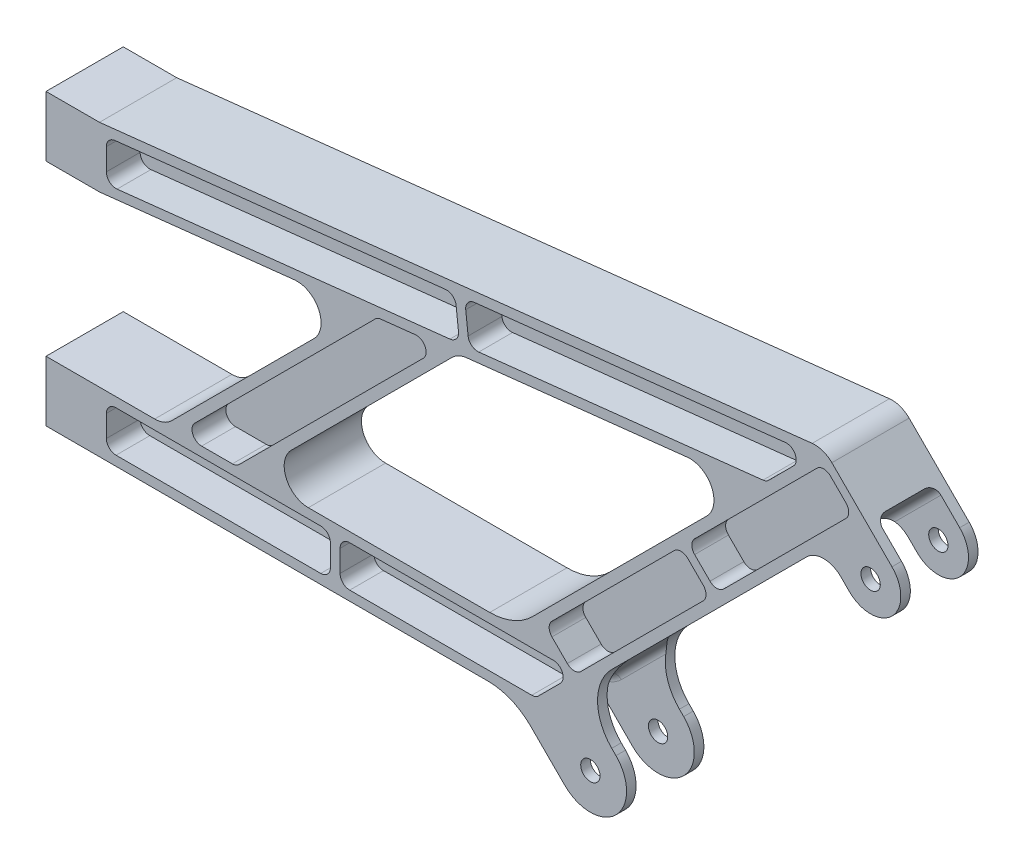
from build123d import *

# Parameters (mm, degrees)
SKETCH1_R               = 4.000000000000007
SKETCH1_R_2             = 4
BOSS_EXTRUDE1_DEPTH     = 32
CUT_EXTRUDE1_DEPTH      = 14
CUT_EXTRUDE2_DEPTH      = 12.0515
CUT_EXTRUDE2_DEPTH_BACK = 12.0515
FILLET1_R               = 4
FILLET2_R               = 4
SKETCH7_R               = 4
SKETCH7_R_2             = 3.999999999999997
SKETCH7_R_3             = 4.000000000000001
SKETCH7_R_4             = 4.0000000000000036
CUT_EXTRUDE3_DEPTH      = 14


with BuildPart() as part:
    # Sketch1 → Boss-Extrude1 (new body)
    with BuildSketch(Plane.XY):
        with BuildLine():
            Line((-16.049733998308586, 33.731487378633574), (8.839559805780222, 8.8381095989473))
            ThreePointArc((8.839559805780222, 8.8381095989473), (12.499999986501061, -0.00051272800107638), (8.838834762594171, -8.838834767069468))
            ThreePointArc((8.838834762594171, -8.838834767069468), (-1.5822419e-09, -12.500000000000004), (-8.838834764831827, -8.838834764831867))
            Line((-8.838834764831827, -8.838834764831867), (-12.374368671510593, -5.303300858153129))
            ThreePointArc((-12.374368671510593, -5.303300858153129), (-19.44543648337603, -2.3743686700186277), (-26.516504295241493, -5.303300858153101))
            Line((-26.516504295241493, -5.303300858153101), (-107.24873734525912, -86.0355339081699))
            ThreePointArc((-107.24873734525912, -86.0355339081699), (-113.10660172152828, -100.17766953190096), (-107.24873734525916, -114.31980515563204))
            Line((-107.24873734525916, -114.31980515563204), (-105.48097039229309, -116.0875721085981))
            ThreePointArc((-105.48097039229309, -116.0875721085981), (-101.08757211009126, -126.69417382639631), (-105.48097039229302, -137.30077554419455))
            ThreePointArc((-105.48097039229302, -137.30077554419455), (-116.0875721100912, -141.69417382639634), (-126.69417382788939, -137.3007755441946))
            Line((-126.69417382788939, -137.3007755441946), (-140.83255286115494, -123.16239651092909))
            ThreePointArc((-140.83255286115494, -123.16239651092909), (-148.94313658169136, -117.74307772781059), (-158.5102223908186, -115.84006604059276))
            Line((-158.5102223908186, -115.84006604059276), (-341.5776016752601, -115.84006604059276))
            Line((-341.5776016752601, -115.84006604059276), (-341.5776016752601, -90.84006604059276))
            Line((-341.5776016752601, -90.84006604059276), (-296.5582702488945, -90.84006604059275))
            ThreePointArc((-296.5582702488945, -90.84006604059275), (-292.7314359252436, -90.0788613657056), (-289.487202437029, -87.91113385245822))
            Line((-289.487202437029, -87.91113385245822), (-230.55965535531007, -28.983586770739237))
            ThreePointArc((-230.55965535531007, -28.983586770739237), (-228.6150903237555, -17.58604644276483), (-238.72309738144492, -11.972362090091522))
            Line((-238.72309738144492, -11.972362090091522), (-319.4176016752601, -20.840290120548644))
            Line((-319.4176016752601, -20.840290120548644), (-341.5776016752601, -20.840290120548637))
            Line((-341.5776016752601, -20.840290120548637), (-341.5776016752601, 4.159709879451362))
            Line((-341.5776016752601, 4.159709879451362), (-319.4176016743681, 4.159709879451346))
            Line((-319.4176016743681, 4.159709879451346), (-24.213756083384812, 36.60115654207939))
            ThreePointArc((-24.213756083384812, 36.60115654207939), (-19.80525783014332, 36.09515683534142), (-16.049733998308586, 33.731487378633574))
        make_face()
        with Locations((-116.08757211009124, -126.69417382639637)):
            Circle(SKETCH1_R, mode=Mode.SUBTRACT)
        with Locations((-2.98344682e-09, -2.98341907e-09)):
            Circle(SKETCH1_R_2, mode=Mode.SUBTRACT)
        with BuildLine():
            Line((-157.76394759633592, -90.84006604059275), (-232.91865994210522, -90.84006604059276))
            ThreePointArc((-232.91865994210522, -90.84006604059276), (-242.1574552672181, -84.66690036424366), (-239.9897277539707, -73.76899822872727))
            Line((-239.9897277539707, -73.76899822872727), (-173.37413117104185, -7.153401645798409))
            ThreePointArc((-173.37413117104185, -7.153401645798409), (-170.62953587528548, -5.2088366142439355), (-167.39543757344612, -4.284312588881645))
            Line((-167.39543757344612, -4.284312588881645), (-75.9815909030455, 5.76161830015324))
            ThreePointArc((-75.9815909030455, 5.76161830015324), (-65.87358384535577, 0.14793394747996658), (-67.81814887691054, -11.249606380494681))
            Line((-67.81814887691054, -11.249606380494681), (-140.08627806667224, -83.51773557025643))
            ThreePointArc((-140.08627806667224, -83.51773557025643), (-148.1968617872087, -88.93705435337492), (-157.76394759633592, -90.84006604059275))
        make_face(mode=Mode.SUBTRACT)
    extrude(amount=BOSS_EXTRUDE1_DEPTH)

    # Sketch2 → Cut-Extrude1 (cut)
    with BuildSketch(Plane.XY.offset(32)):
        with BuildLine():
            ThreePointArc((-140.36697797666704, -111.84006604059275), (-138.83624424720668, -111.5355841706379), (-137.53855085192086, -110.66849316533893))
            Line((-137.53855085192086, -110.66849316533893), (-128.53855085192086, -101.66849316533907))
            ThreePointArc((-128.53855085192086, -101.66849316533907), (-127.67145984662184, -97.30933231113245), (-131.36697797666707, -94.84006604059279))
            Line((-131.36697797666707, -94.84006604059279), (-215.7700216370809, -94.8400660405928))
            ThreePointArc((-215.7700216370809, -94.8400660405928), (-218.59844876182711, -96.01163891584663), (-219.77002163708093, -98.84006604059284))
            Line((-219.77002163708093, -98.84006604059284), (-219.77002163708093, -107.84006604059273))
            ThreePointArc((-219.77002163708093, -107.84006604059273), (-218.59844876182711, -110.66849316533894), (-215.7700216370809, -111.84006604059277))
            Line((-215.7700216370809, -111.84006604059277), (-140.36697797666704, -111.84006604059275))
        make_face()
        with BuildLine():
            ThreePointArc((-16.614921092650253, 28.639448841971976), (-19.44341616830374, 29.811253754782516), (-22.27200736402945, 28.63968088289363))
            Line((-22.27200736402945, 28.63968088289363), (-72.89302846182751, -21.98134021490415))
            ThreePointArc((-72.89302846182751, -21.981340214904154), (-74.06460133708134, -24.809767339650364), (-72.89302846182751, -27.638194464396573))
            Line((-72.89302846182751, -27.638194464396573), (-66.52906743114904, -34.00215549507503))
            ThreePointArc((-66.52906743114904, -34.00215549507503), (-63.70064030640285, -35.17372837032886), (-60.872213181656655, -34.00215549507506))
            Line((-60.872213181656655, -34.00215549507506), (-10.251714154519497, 16.618343532061083))
            ThreePointArc((-10.251714154519505, 16.618343532061086), (-9.080141282630589, 19.446606585827766), (-10.251482132632672, 22.27496574063185))
            Line((-10.251482132632672, 22.27496574063185), (-16.614921092650253, 28.639448841971976))
        make_face()
        with BuildLine():
            ThreePointArc((-125.63351365610953, -93.10660172003544), (-122.80508653136334, -94.27817459528924), (-119.97665940661716, -93.10660172003546))
            Line((-119.97665940661716, -93.10660172003546), (-69.35749455589527, -42.48743686931361))
            ThreePointArc((-69.35749455589527, -42.48743686931361), (-68.18592168064143, -39.6590097445674), (-69.35749455589527, -36.83058261982118))
            Line((-69.35749455589527, -36.83058261982118), (-75.7214555865737, -30.466621589142765))
            ThreePointArc((-75.7214555865737, -30.46662158914276), (-78.5498827113199, -29.295048713888928), (-81.37830983606611, -30.46662158914277))
            Line((-81.37830983606611, -30.466621589142765), (-131.99747468678797, -81.08578643986458))
            ThreePointArc((-131.99747468678797, -81.08578643986458), (-133.1690475620418, -83.91421356461078), (-131.997474686788, -86.74264068935697))
            Line((-131.997474686788, -86.74264068935697), (-125.63351365610953, -93.10660172003544))
        make_face()
        with BuildLine():
            ThreePointArc((-316.57760167526004, -107.84006604059273), (-315.40602880000625, -110.66849316533893), (-312.57760167526004, -111.84006604059276))
            Line((-312.57760167526004, -111.84006604059275), (-227.77002163708124, -111.84006604059277))
            ThreePointArc((-227.77002163708124, -111.84006604059277), (-224.94159451233503, -110.66849316533894), (-223.77002163708121, -107.84006604059273))
            Line((-223.77002163708121, -107.84006604059273), (-223.77002163708121, -98.84006604059284))
            ThreePointArc((-223.77002163708121, -98.84006604059284), (-224.94159451233503, -96.01163891584663), (-227.77002163708124, -94.8400660405928))
            Line((-227.77002163708124, -94.8400660405928), (-312.57760167526004, -94.84006604059277))
            ThreePointArc((-312.57760167526004, -94.84006604059276), (-315.40602880000625, -96.01163891584659), (-316.57760167526004, -98.84006604059279))
            Line((-316.57760167526004, -98.84006604059279), (-316.57760167526004, -107.84006604059273))
        make_face()
        with BuildLine():
            Line((-176.10914312924507, 15.884521302439035), (-313.01455136096786, 0.8392921656597465))
            ThreePointArc((-313.01455136096786, 0.8392921656597538), (-315.5565107660877, -0.46729486018339195), (-316.57760167526004, -3.136770581853166))
            Line((-316.57760167526004, -3.136770581853166), (-316.57760167526, -12.190953648392952))
            ThreePointArc((-316.57760167526, -12.190953648392952), (-315.2470773969298, -15.169862739220632), (-312.14065198955217, -16.16701639590586))
            Line((-312.14065198955217, -16.167016395905847), (-174.25210696498712, -1.0137453744908704))
            ThreePointArc((-174.25210696498712, -1.01374537449087), (-171.56858563370398, 0.45978652763373384), (-170.71299390318194, 3.399267058729826))
            Line((-170.71299390318194, 3.3992670587298264), (-171.69613069602437, 12.345408240633859))
            ThreePointArc((-171.69613069602437, 12.345408240633857), (-173.169662598149, 15.028929571917006), (-176.10914312924507, 15.884521302439046))
        make_face()
        with BuildLine():
            Line((-42.183809278934454, 14.384733217481418), (-32.01176917416371, 24.556773322252173))
            ThreePointArc((-32.01176917416371, 24.556773322252173), (-31.233943161541813, 29.115789453442037), (-35.277145984617704, 31.361263194511345))
            Line((-35.277145984617704, 31.361263194511345), (-164.18095488670633, 17.195370359562308))
            ThreePointArc((-164.18095488670633, 17.195370359562315), (-166.86447621798948, 15.721838457437714), (-167.7200679485115, 12.782357926341632))
            Line((-167.7200679485115, 12.782357926341632), (-166.73693115566908, 3.836216744437582))
            ThreePointArc((-166.73693115566908, 3.836216744437583), (-165.2633992535445, 1.1526954131544191), (-162.32391872244838, 0.2971036826323883))
            Line((-162.32391872244838, 0.29710368263239556), (-44.575286717972915, 13.237097594714685))
            ThreePointArc((-44.575286717972915, 13.237097594714685), (-43.28164739723707, 13.606907204859585), (-42.183809278934454, 14.384733217481418))
        make_face()
        with BuildLine():
            ThreePointArc((-202.85670331502968, -8.181330796222849), (-204.15034263576544, -8.551140406367741), (-205.248180754068, -9.328966418989541))
            Line((-205.248180754068, -9.328966418989541), (-279.930853250925, -84.01163891584659))
            ThreePointArc((-279.930853250925, -84.01163891584659), (-280.7979442562239, -88.37079977005313), (-277.1024261261788, -90.84006604059273))
            Line((-277.1024261261788, -90.84006604059275), (-264.3745040648209, -90.84006604059276))
            ThreePointArc((-264.3745040648209, -90.84006604059276), (-262.84377033536055, -90.53558417063786), (-261.5460769400747, -89.66849316533892))
            Line((-261.5460769400747, -89.66849316533892), (-185.29197639124462, -13.414392616508824))
            ThreePointArc((-185.29197639124462, -13.414392616508824), (-184.51415037862282, -8.855376485318981), (-188.5573532016987, -6.609902744249732))
            Line((-188.5573532016987, -6.609902744249734), (-202.85670331502968, -8.181330796222849))
        make_face()
    cut_extrude1 = extrude(amount=-CUT_EXTRUDE1_DEPTH, mode=Mode.SUBTRACT)

    # Mirror1: Cut-Extrude1 across plane
    add(cut_extrude1.mirror(Plane.XY.offset(16)), mode=Mode.SUBTRACT)

    # Sketch3 → Cut-Extrude2 (cut, two sides: drawn at the far end of the back side and taken through both)
    with BuildSketch(Plane.XY.offset(16).offset(-CUT_EXTRUDE2_DEPTH_BACK)):
        with BuildLine():
            Line((-158.5102223908186, -115.84006604059276), (-141.19540510141326, -115.84006604059277))
            ThreePointArc((-141.19540510141326, -115.84006604059277), (-137.3685707777624, -115.07886136570563), (-134.1243372895478, -112.91113385245826))
            Line((-134.1243372895478, -112.91113385245826), (-98.96898095039894, -77.75577751330981))
            Line((-98.96898095039894, -77.75577751330981), (-66.35974339813797, -110.01855027197146))
            Line((-66.35974339813797, -110.01855027197146), (-116.59713847003755, -149.21856691920738))
            Line((-116.59713847003755, -149.21856691920738), (-158.5102223908186, -115.84006604059276))
        make_face()
        Polygon((-29.015558543217246, -7.8023551061288385), (7.8698142046997255, 29.08301764178775), (26.353299234567167, -15.387889096839226), (-12.041020580309814, -17.81897048249737), align=None)
    extrude(amount=CUT_EXTRUDE2_DEPTH + CUT_EXTRUDE2_DEPTH_BACK, mode=Mode.SUBTRACT)

    # Fillet1
    fillet1_edges = [part.edges().sort_by_distance(p)[0] for p in [
        (-14.141700563915723, 7.07150287317253, 28.0515),
        (-14.141700563915723, 7.07150287317253, 3.9484999999999992),
    ]]
    fillet(fillet1_edges, radius=FILLET1_R)

    # Fillet2
    fillet2_edges = [part.edges().sort_by_distance(p)[0] for p in [
        (-149.85281374611594, -115.84006604059277, 3.9484999999999992),
        (-137.3685707777624, -115.07886136570563, 3.9484999999999992),
        (-149.85281374611594, -115.84006604059277, 28.0515),
        (-137.3685707777624, -115.07886136570563, 28.0515),
        (-120.68653731740346, -99.47333388031407, 3.9484999999999992),
        (-120.68653731740346, -99.47333388031407, 28.0515),
    ]]
    fillet(fillet2_edges, radius=FILLET2_R)

    # Sketch7 → Cut-Extrude3 (cut)
    with BuildSketch(Plane.ZY.offset(341.5776016752601)):
        with Locations((24.000000000000014, -107.8400660405927)):
            Circle(SKETCH7_R)
        with Locations((7.999999999999993, -98.84006604058857)):
            Circle(SKETCH7_R_2)
        with Locations((8.000000000000004, -3.8402901205486373)):
            Circle(SKETCH7_R_3)
        with Locations((23.999999999999996, -12.840290120548637)):
            Circle(SKETCH7_R_4)
    extrude(amount=-CUT_EXTRUDE3_DEPTH, mode=Mode.SUBTRACT)


solid = part.part
